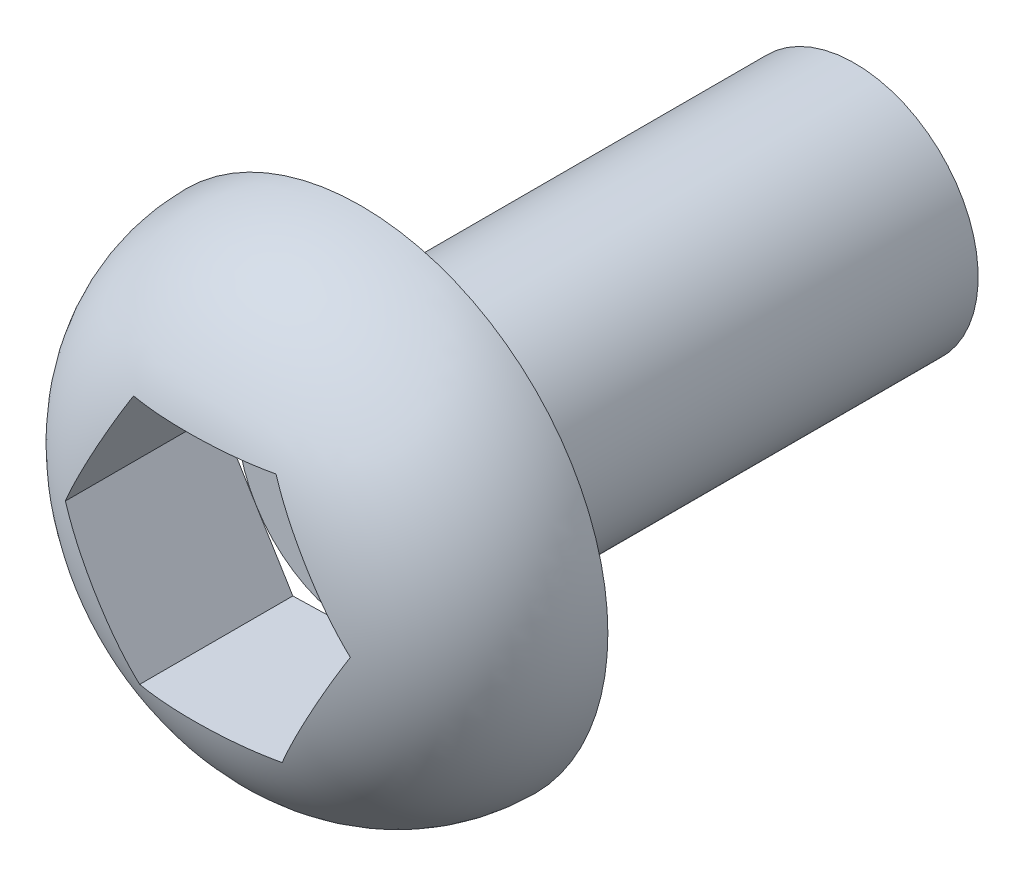
from build123d import *

# Parameters (mm, degrees)
SKETCH1_R           = 3
BOSS_EXTRUDE1_DEPTH = 2
FILLET1_R           = 2
CUT_EXTRUDE1_DEPTH  = 2
SKETCH3_R           = 1.5
BOSS_EXTRUDE2_DEPTH = 6


with BuildPart() as part:
    # Sketch1 → Boss-Extrude1 (new body)
    with BuildSketch(Plane.XY):
        Circle(SKETCH1_R)
    extrude(amount=BOSS_EXTRUDE1_DEPTH)

    # Fillet1
    fillet1_edges = [part.edges().sort_by_distance(p)[0] for p in [
        (-3, 0, 2),
    ]]
    fillet(fillet1_edges, radius=FILLET1_R - 0.0001)  # a hair under: the kernel refuses the full size

    # Sketch2 → Cut-Extrude1 (cut)
    with BuildSketch(Plane.XY.offset(2)):
        Polygon((0.903043901, -1.478009375), (1.731515616, 0.043054272), (0.828471715, 1.521063647), (-0.903043901, 1.478009375), (-1.731515616, -0.043054272), (-0.828471715, -1.521063647), align=None)
    extrude(amount=-CUT_EXTRUDE1_DEPTH, mode=Mode.SUBTRACT)


with BuildPart() as body_2:
    # Sketch3 → Boss-Extrude2 (new body)
    with BuildSketch(Plane(origin=(0, 0, 0), x_dir=(-1, 0, 0), z_dir=(0, 0, -1))):
        Circle(SKETCH3_R)
    extrude(amount=BOSS_EXTRUDE2_DEPTH)


solid = Compound([part.part, body_2.part])
